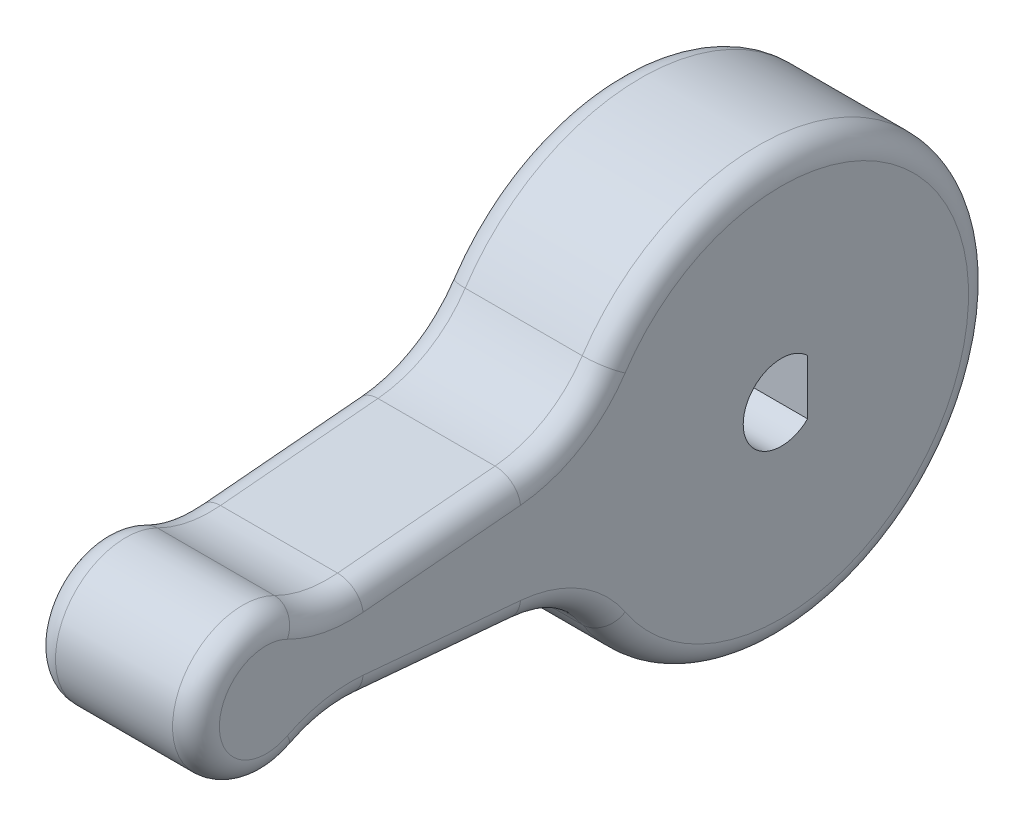
from build123d import *

# Parameters (mm, degrees)
BOSS_EXTRUDE1_DEPTH = 3.5
FILLET1_R           = 5
HOLE1_D             = 3
HOLE1_DEPTH         = 9
HOLE1_CBORE_D       = 4
HOLE1_CBORE_DEPTH   = 4
FILLET2_R           = 1


with BuildPart() as part:
    # Sketch1 → Boss-Extrude1 (new, symmetric)
    with BuildSketch(Plane(origin=(0, 0, 0), x_dir=(0, 0, -1), z_dir=(1, 0, 0))):
        with BuildLine():
            Line((-19.763932023, 2), (-8.485281374, 3))
            ThreePointArc((-8.485281374, 3), (9, 0), (-8.485281374, -3))
            Line((-8.485281374, -3), (-19.763932023, -2))
            ThreePointArc((-19.763932023, -2), (-25, 0), (-19.763932023, 2))
        make_face()
        with BuildLine():
            Line((1.125, -1.17260394), (1.125, 1.17260394))
            ThreePointArc((1.125, 1.17260394), (-1.625, 0), (1.125, -1.17260394))
        make_face(mode=Mode.SUBTRACT)
    extrude(amount=BOSS_EXTRUDE1_DEPTH, both=True)

    # Fillet1
    fillet1_edges = [part.edges().sort_by_distance(p)[0] for p in [
        (0, 2, 19.763932023),
        (0, -3, 8.485281374),
        (0, -2, 19.763932023),
        (0, 3, 8.485281374),
    ]]
    fillet(fillet1_edges, radius=FILLET1_R)

    # Hole1
    with Locations(Plane(origin=(0, 0, -9.125), x_dir=(1, 0, 0), z_dir=(0, 0, -1))):
        with Locations((0, 0)):
            CounterBoreHole(HOLE1_D / 2, HOLE1_CBORE_D / 2, HOLE1_CBORE_DEPTH, depth=HOLE1_DEPTH)

    # Fillet2
    fillet2_edges = [part.edges().sort_by_distance(p)[0] for p in [
        (-3.5, -3.440789323, 9.110481838),
        (-3.5, -2.458817952, 14.589084631),
        (-3.5, -2.230698388, 19.336127101),
        (-3.5, 0, 25),
        (-3.5, 2.230698388, 19.336127101),
        (-3.5, 2.458817952, 14.589084631),
        (-3.5, 3.440789323, 9.110481838),
        (3.5, -3.440789323, 9.110481838),
        (3.5, -2.458817952, 14.589084631),
        (3.5, -2.230698388, 19.336127101),
        (3.5, 0, 25),
        (3.5, 2.230698388, 19.336127101),
        (3.5, 2.458817952, 14.589084631),
        (3.5, 3.440789323, 9.110481838),
        (-3.5, 0, -9),
        (3.5, 0, -9),
    ]]
    fillet(fillet2_edges, radius=FILLET2_R)


solid = part.part
